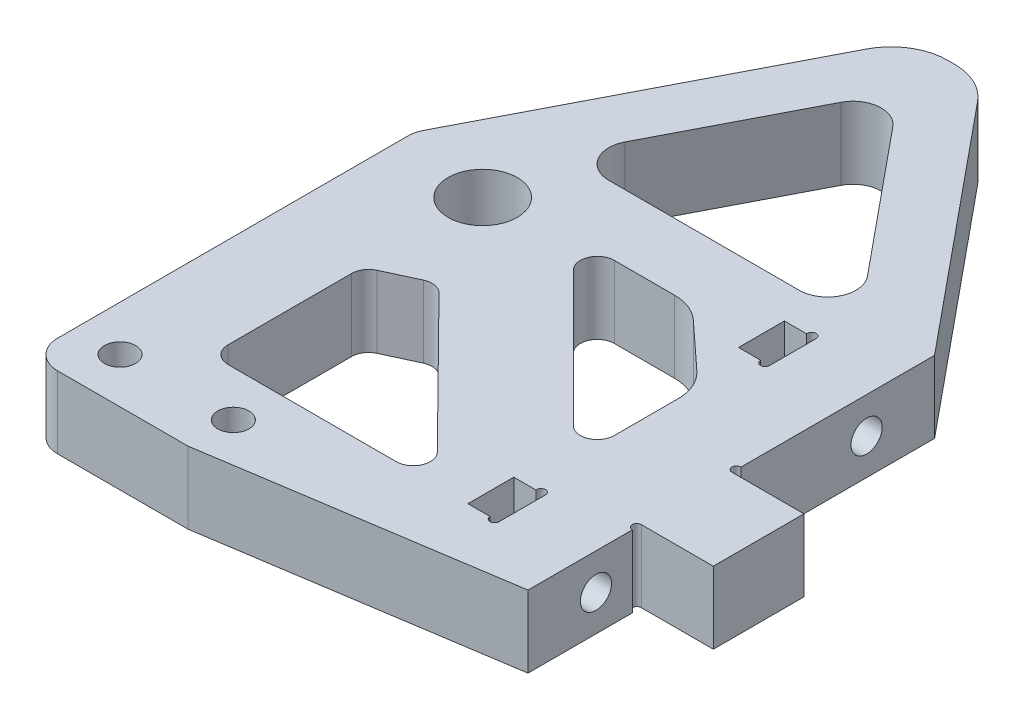
from build123d import *

# Parameters (mm, degrees)
SKETCH1_R           = 6.1
SKETCH1_R_2         = 2.75
BOSS_EXTRUDE1_DEPTH = 12.7
FILLET1_R           = 10
CUT_EXTRUDE1_DEPTH  = 144.126831866
FILLET2_R           = 5
CUT_EXTRUDE2_DEPTH  = 144.126831866
SKETCH6_R           = 2.75
CUT_EXTRUDE3_DEPTH  = 137.287526942
FILLET3_R           = 3
FILLET4_R           = 5


with BuildPart() as part:
    # Sketch1 → Boss-Extrude1 (new body)
    with BuildSketch(Plane(origin=(0, 0, 0), x_dir=(1, 0, 0), z_dir=(0, 1, 0))):
        with BuildLine():
            Line((-80, 0), (-80, 60))
            Line((-80, 60), (-50, 118))
            Line((-50, 118), (-38, 118))
            Line((-38, 118), (0, 71.75))
            Line((0, 71.75), (0, 37.6))
            ThreePointArc((0, 37.6), (-0.8, 36.8), (0, 36))
            Line((0, 36), (12.7, 36))
            Line((12.7, 36), (12.7, 20))
            Line((12.7, 20), (0, 20))
            ThreePointArc((0, 20), (-0.8, 19.2), (0, 18.4))
            Line((0, 18.4), (0, 0))
            Line((0, 0), (-52, -8))
            Line((-52, -8), (-80, -8))
            Line((-80, -8), (-80, 0))
        make_face()
        with Locations((-64, 56)):
            Circle(SKETCH1_R, mode=Mode.SUBTRACT)
        with Locations((-72, 0)):
            Circle(SKETCH1_R_2, mode=Mode.SUBTRACT)
        with Locations((-52, 0)):
            Circle(SKETCH1_R_2, mode=Mode.SUBTRACT)
    extrude(amount=BOSS_EXTRUDE1_DEPTH)

    # Fillet1
    fillet1_edges = [part.edges().sort_by_distance(p)[0] for p in [
        (-38, 6.35, -118),
        (-50, 6.35, -118),
    ]]
    fillet(fillet1_edges, radius=FILLET1_R)

    # Sketch3 → Cut-Extrude1 (cut, through all)
    with BuildSketch(Plane(origin=(0, 12.7, 0), x_dir=(1, 0, 0), z_dir=(0, 1, 0))):
        Polygon((-11.299175731, 69.75), (-43.455065626, 108.887102833), (-63.698394678, 69.75), align=None)
        with BuildLine():
            Line((-29.108244654, 13.108163555), (-54.701743004, 39.020129073))
            Line((-54.701743004, 39.020129073), (-63.944660113, 34.744244414))
            Line((-63.944660113, 34.744244414), (-63.944660113, 8))
            Line((-63.944660113, 8), (-31.242640687, 8))
            ThreePointArc((-31.242640687, 8), (-28.47456458, 9.843386552), (-29.108244654, 13.108163555))
        make_face()
        with BuildLine():
            Line((-42.757359313, 58), (-32.127870675, 58))
            ThreePointArc((-32.127870675, 58), (-29.214746961, 57.450752326), (-26.701629853, 55.878427557))
            Line((-26.701629853, 55.878427557), (-18.573759178, 48.375777703))
            ThreePointArc((-18.573759178, 48.375777703), (-16.671632973, 45.705938108), (-16, 42.497350146))
            Line((-16, 42.497350146), (-16, 31.242640687))
            ThreePointArc((-16, 31.242640687), (-17.851949703, 28.47100209), (-21.121320344, 29.121320344))
            Line((-21.121320344, 29.121320344), (-44.878679656, 52.878679656))
            ThreePointArc((-44.878679656, 52.878679656), (-45.52899791, 56.148050297), (-42.757359313, 58))
        make_face()
    extrude(amount=-CUT_EXTRUDE1_DEPTH, mode=Mode.SUBTRACT)

    # Fillet2
    fillet2_edges = [part.edges().sort_by_distance(p)[0] for p in [
        (-43.455065626, 6.35, -108.887102833),
        (-11.299175731, 6.35, -69.75),
        (-63.698394678, 6.35, -69.75),
    ]]
    fillet(fillet2_edges, radius=FILLET2_R)

    # Sketch4 → Cut-Extrude2 (cut, through all)
    with BuildSketch(Plane(origin=(0, 12.7, 0), x_dir=(1, 0, 0), z_dir=(0, 1, 0))):
        with BuildLine():
            Line((-18.5, 16), (-18.5, 7.9))
            Line((-18.5, 7.9), (-14.6, 7.9))
            ThreePointArc((-14.6, 7.9), (-13.8, 7.1), (-13, 7.9))
            Line((-13, 7.9), (-13, 16.1))
            ThreePointArc((-13, 16.1), (-13.85009833, 16.898429807), (-14.593725393, 16))
            Line((-14.593725393, 16), (-18.5, 16))
        make_face()
        with BuildLine():
            Line((-18.5, 55.65), (-14.6, 55.65))
            ThreePointArc((-14.6, 55.65), (-13.8, 54.85), (-13, 55.65))
            Line((-13, 55.65), (-13, 63.85))
            ThreePointArc((-13, 63.85), (-13.85009833, 64.648429807), (-14.593725393, 63.75))
            Line((-14.593725393, 63.75), (-18.5, 63.75))
            Line((-18.5, 63.75), (-18.5, 55.65))
        make_face()
    extrude(amount=-CUT_EXTRUDE2_DEPTH, mode=Mode.SUBTRACT)

    # Sketch6 → Cut-Extrude3 (cut, through all)
    with BuildSketch(Plane.ZY.offset(13)):
        with Locations((-12, 6.35)):
            Circle(SKETCH6_R)
        with Locations((-59.75, 6.35)):
            Circle(SKETCH6_R)
    extrude(amount=-CUT_EXTRUDE3_DEPTH, mode=Mode.SUBTRACT)

    # Fillet3
    fillet3_edges = [part.edges().sort_by_distance(p)[0] for p in [
        (-54.701743004, 6.35, -39.020129073),
        (-63.944660113, 6.35, -8),
        (-63.944660113, 6.35, -34.744244414),
    ]]
    fillet(fillet3_edges, radius=FILLET3_R)

    # Fillet4
    fillet4_edges = [part.edges().sort_by_distance(p)[0] for p in [
        (-80, 6.35, 8),
        (-80, 6.35, -60),
    ]]
    fillet(fillet4_edges, radius=FILLET4_R)


solid = part.part
